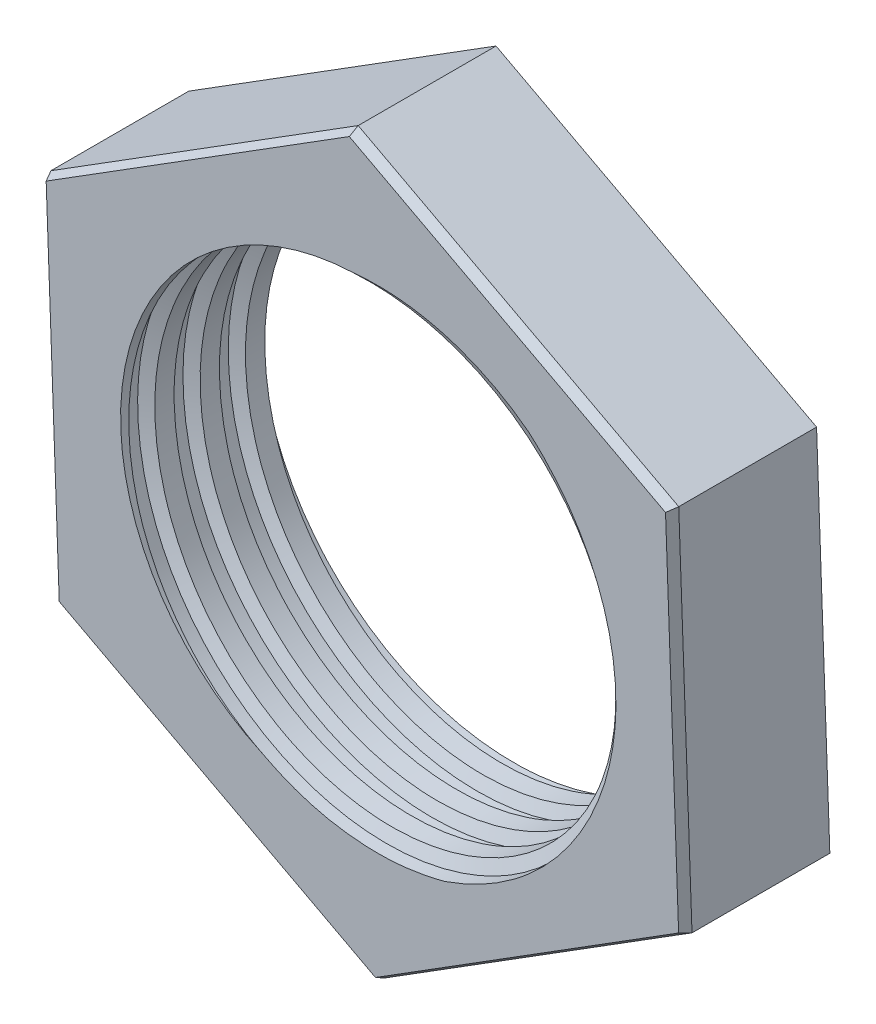
from build123d import *
from OCP.BRepFilletAPI import BRepFilletAPI_MakeChamfer

# Parameters (mm, degrees)
SKETCH1_R           = 8
BOSS_EXTRUDE1_DEPTH = 5
CUT_SWEEP1_PITCH    = 1.5
CHAMFER1_SIZE       = 0.3
CHAMFER1_SIZE2      = 0.139892297


with BuildPart() as part:
    # Sketch1 → Boss-Extrude1 (new body)
    with BuildSketch(Plane.XY):
        Polygon((10.165837862, 6.376185425), (-0.439019626, 11.991966551), (-10.604857488, 5.615781126), (-10.165837862, -6.376185425), (0.439019626, -11.991966551), (10.604857488, -5.615781126), align=None)
        Circle(SKETCH1_R, mode=Mode.SUBTRACT)
    extrude(amount=BOSS_EXTRUDE1_DEPTH)

    # Cut-Sweep1: arcs per turn and ends read off the stored shape
    # Cut-Sweep1: the profile of Sketch3 screwed along a right-hand helix through 5 turns, 8 arcs to a turn; built about Z, then put on its axis
    cut_sweep1_z = Axis((0, 0, 0), (0, 0, 1))
    cut_sweep1_corners = [(7.851099618, 5.3441e-05, -1.046060596), (7.851099618, 5.3441e-05, -2.046060596), (8.387226348, 5.709e-05, -1.796060596), (8.387226348, 5.709e-05, -1.296060596)]
    with BuildLine(mode=Mode.PRIVATE) as cut_sweep1_profile:
        Line(cut_sweep1_corners[0], cut_sweep1_corners[1])
        Line(cut_sweep1_corners[1], cut_sweep1_corners[2])
        Line(cut_sweep1_corners[2], cut_sweep1_corners[3])
        Line(cut_sweep1_corners[3], cut_sweep1_corners[0])
    cut_sweep1_cap = Face(cut_sweep1_profile.wire())
    cut_sweep1_turn_angles = [0, 22.5, 45, 67.5, 90, 112.5, 135, 157.5, 180, 202.5, 225, 247.5, 270, 292.5, 315, 337.5, 360]
    cut_sweep1_turn_weights = [1, 0.9238795325112867, 1, 0.9238795325112867, 1, 0.9238795325112867, 1, 0.9238795325112867, 1, 0.9238795325112867, 1, 0.9238795325112867, 1, 0.9238795325112867, 1, 0.9238795325112867, 1]
    cut_sweep1_turn_rails = [Edge.make_bspline([Vector(p[0], p[1], 0).rotate(cut_sweep1_z, cut_sweep1_turn_angles[k]) / cut_sweep1_turn_weights[k] + Vector(0, 0, p[2] + CUT_SWEEP1_PITCH * cut_sweep1_turn_angles[k] / 360) for k in range(17)], [0, 0, 0, 1, 1, 2, 2, 3, 3, 4, 4, 5, 5, 6, 6, 7, 7, 8, 8, 8], 2, cut_sweep1_turn_weights) for p in cut_sweep1_corners]
    cut_sweep1_turn_sides = [Face.make_surface_from_curves(cut_sweep1_turn_rails[p[0]], cut_sweep1_turn_rails[p[1]]) for p in [(0, 1), (1, 2), (2, 3), (3, 0)]]
    cut_sweep1 = Plane(origin=(0, 0, 5), x_dir=(1, 0, 0), z_dir=(0, 0, -1)) * Solid(Shell([*[p.moved(Location((0, 0, CUT_SWEEP1_PITCH * i))) for i in range(5) for p in cut_sweep1_turn_sides], cut_sweep1_cap, cut_sweep1_cap.rotate(cut_sweep1_z, 1800).moved(Location((0, 0, CUT_SWEEP1_PITCH * 1800 / 360)))]))
    add(cut_sweep1, mode=Mode.SUBTRACT)

    # Chamfer1: one chamfer whose edges measure the first distance from different faces: ONE call of the kernel's chamfer builder (chamfer() names one face for all edges)
    chamfer1_edges_1 = [part.edges().sort_by_distance(p)[0] for p in [
        (-5.521938557, 8.803873839, 5),
    ]]
    chamfer1_side_1 = [part.faces().sort_by_distance(p)[0] for p in [
        (-5.521938557, 8.803873839, 2.5),
    ]]
    chamfer1_edges_2 = [part.edges().sort_by_distance(p)[0] for p in [
        (-10.385347675, -0.380202149, 5),
    ]]
    chamfer1_side_2 = [part.faces().sort_by_distance(p)[0] for p in [
        (-10.385347675, -0.380202149, 2.5),
    ]]
    chamfer1_edges_3 = [part.edges().sort_by_distance(p)[0] for p in [
        (-4.863409118, -9.184075988, 5),
    ]]
    chamfer1_side_3 = [part.faces().sort_by_distance(p)[0] for p in [
        (-4.863409118, -9.184075988, 2.5),
    ]]
    chamfer1_edges_4 = [part.edges().sort_by_distance(p)[0] for p in [
        (5.521938557, -8.803873839, 5),
    ]]
    chamfer1_side_4 = [part.faces().sort_by_distance(p)[0] for p in [
        (5.521938557, -8.803873839, 2.5),
    ]]
    chamfer1_edges_5 = [part.edges().sort_by_distance(p)[0] for p in [
        (10.385347675, 0.380202149, 5),
    ]]
    chamfer1_side_5 = [part.faces().sort_by_distance(p)[0] for p in [
        (10.385347675, 0.380202149, 2.5),
    ]]
    chamfer1_edges_6 = [part.edges().sort_by_distance(p)[0] for p in [
        (5.521938557, -8.803873839, 0),
        (-4.863409118, -9.184075988, 0),
        (-10.385347675, -0.380202149, 0),
        (-5.521938557, 8.803873839, 0),
        (4.863409118, 9.184075988, 0),
        (10.385347675, 0.380202149, 0),
    ]]
    chamfer1_side_6 = [part.faces().sort_by_distance(p)[0] for p in [
        (4.713575925, 8.901130549, 0),
    ]]
    chamfer1_edges_7 = [part.edges().sort_by_distance(p)[0] for p in [
        (4.863409118, 9.184075988, 5),
    ]]
    chamfer1_side_7 = [part.faces().sort_by_distance(p)[0] for p in [
        (4.863409118, 9.184075988, 2.5),
    ]]
    chamfer1 = BRepFilletAPI_MakeChamfer(part.part.solid().wrapped)
    for e in chamfer1_edges_1:
        chamfer1.Add(CHAMFER1_SIZE, CHAMFER1_SIZE2, e.wrapped, chamfer1_side_1[0].wrapped)  # the first distance lies on this face
    for e in chamfer1_edges_2:
        chamfer1.Add(CHAMFER1_SIZE, CHAMFER1_SIZE2, e.wrapped, chamfer1_side_2[0].wrapped)  # the first distance lies on this face
    for e in chamfer1_edges_3:
        chamfer1.Add(CHAMFER1_SIZE, CHAMFER1_SIZE2, e.wrapped, chamfer1_side_3[0].wrapped)  # the first distance lies on this face
    for e in chamfer1_edges_4:
        chamfer1.Add(CHAMFER1_SIZE, CHAMFER1_SIZE2, e.wrapped, chamfer1_side_4[0].wrapped)  # the first distance lies on this face
    for e in chamfer1_edges_5:
        chamfer1.Add(CHAMFER1_SIZE, CHAMFER1_SIZE2, e.wrapped, chamfer1_side_5[0].wrapped)  # the first distance lies on this face
    for e in chamfer1_edges_6:
        chamfer1.Add(CHAMFER1_SIZE, CHAMFER1_SIZE2, e.wrapped, chamfer1_side_6[0].wrapped)  # the first distance lies on this face
    for e in chamfer1_edges_7:
        chamfer1.Add(CHAMFER1_SIZE, CHAMFER1_SIZE2, e.wrapped, chamfer1_side_7[0].wrapped)  # the first distance lies on this face
    add(Compound.cast(chamfer1.Shape()), mode=Mode.REPLACE)


solid = part.part
